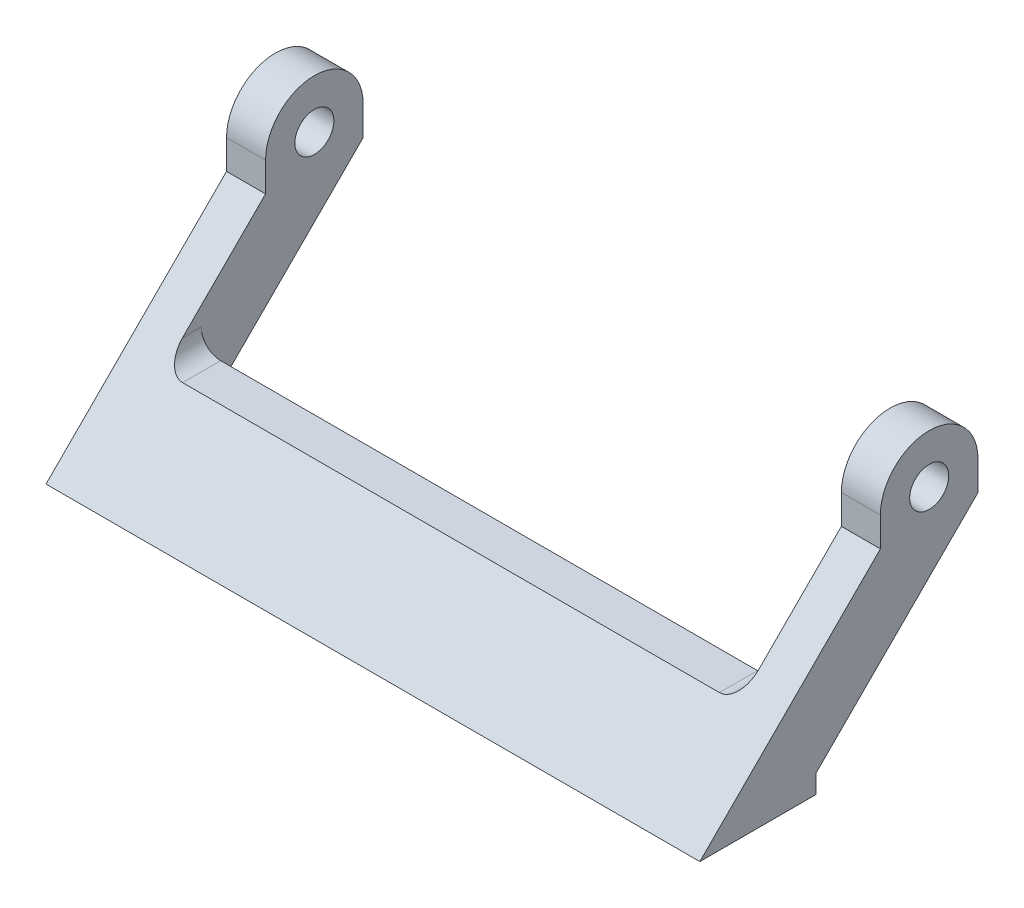
from build123d import *

# Parameters (mm, degrees)
ESBO_O1_R                  = 2
RESSALTO_EXTRUS_O1_DEPTH   = 33.5
CORTE_EXTRUS_O3_START      = -5
CORTE_EXTRUS_O3_DEPTH      = 23.196699141
CORTE_EXTRUS_O4_DEPTH      = 47.084705336
CORTE_EXTRUS_O4_DEPTH_BACK = 47.084705336
ESBO_O4_W                  = 59
ESBO_O4_H                  = 6.231727984
CORTE_EXTRUS_O5_DEPTH      = 44.128413036
RESSALTO_EXTRUS_O3_START   = -29.398953743
RESSALTO_EXTRUS_O3_DEPTH   = 58.797908802
ESBO_O6_W                  = 59
ESBO_O6_H                  = 4.4
RESSALTO_EXTRUS_O4_DEPTH   = 0.5
CORTE_EXTRUS_O6_DEPTH      = 71.593909086
FILETE1_R                  = 2


# Read off the part's stored shape, not the designer's step: Corte-extrusão3, Ressalto-extrusão3
with BuildPart() as part:
    # Esboço1 → Ressalto-extrusão1 (new, symmetric)
    with BuildSketch(Plane(origin=(0, 0, 0), x_dir=(0, 0, -1), z_dir=(1, 0, 0))):
        with BuildLine():
            Line((-5, 0), (-5, -3))
            Line((-5, -3), (-23.5, -21.5))
            Line((-23.5, -21.5), (-11.6, -21.5))
            Line((-11.6, -21.5), (-11.6, -19.6))
            Line((-11.6, -19.6), (5, -3))
            Line((5, -3), (5, 0))
            ThreePointArc((5, 0), (0, 5), (-5, 0))
        make_face()
        Circle(ESBO_O1_R, mode=Mode.SUBTRACT)
    extrude(amount=RESSALTO_EXTRUS_O1_DEPTH, both=True)

    # Corte-extrusão3 outline → Corte-extrusão3 (cut)
    with BuildSketch(Plane.XY.offset(CORTE_EXTRUS_O3_START)):
        with BuildLine():
            Line((-25.5, -16.196699141), (25.5, -16.196699141))
            add(Edge.make_bspline(
                [(25.5, -16.196699141), (29.5, -16.196699141), (29.5, -13.368272016)],
                knots=[3.141592654, 3.141592654, 3.141592654, 4.71238898, 4.71238898, 4.71238898], degree=2, weights=[1, 0.707106781, 1]))
            Line((29.5, -13.368272016), (29.5, 6))
            Line((29.5, 6), (-29.5, 6))
            Line((-29.5, 6), (-29.5, -13.368272016))
            add(Edge.make_bspline(
                [(-29.5, -13.368272016), (-29.5, -16.196699141), (-25.5, -16.196699141)],
                knots=[4.71238898, 4.71238898, 4.71238898, 6.283185307, 6.283185307, 6.283185307], degree=2, weights=[1, 0.707106781, 1]))
        make_face()
    extrude(amount=CORTE_EXTRUS_O3_DEPTH, mode=Mode.SUBTRACT)

    # Esboço4 → Corte-extrusão4 (cut, two sides: drawn at the far end of the back side and taken through both)
    with BuildSketch(Plane(origin=(0, -16.196699141, 0), x_dir=(1, 0, 0), z_dir=(0, 1, 0)).offset(-CORTE_EXTRUS_O4_DEPTH_BACK)):
        with Locations((0, -8.484136008)):
            Rectangle(ESBO_O4_W, ESBO_O4_H)
    extrude(amount=CORTE_EXTRUS_O4_DEPTH + CORTE_EXTRUS_O4_DEPTH_BACK, mode=Mode.SUBTRACT)

    # Esboço5 → Corte-extrusão5 (cut, through all)
    with BuildSketch(Plane(origin=(0, 0, 11.6), x_dir=(-1, 0, 0), z_dir=(0, 0, -1))):
        with BuildLine():
            Line((29.398953619, -14), (29.5, -14))
            Line((29.5, -14), (29.5, -13.368272016))
            add(Edge.make_bspline(
                [(29.398953619, -14), (29.423863493, -13.923129609), (29.445428126, -13.845331175), (29.463538827, -13.766752142), (29.478105641, -13.68755334), (29.489060697, -13.607909452), (29.49636233, -13.528009486), (29.5, -13.448057281), (29.5, -13.368272016)],
                knots=[0.878269136, 0.878269136, 0.878269136, 0.878269136, 0.878269136, 0.878269136, 0.878269136, 0.878269136, 0.878269136, 1, 1, 1, 1, 1, 1, 1, 1, 1], degree=8))
        make_face()
        with BuildLine():
            Line((-29.5, -14), (-29.39895364, -14))
            add(Edge.make_bspline(
                [(-29.5, -13.368272016), (-29.5, -13.38237401), (-29.499886362, -13.396480452), (-29.499658961, -13.410590284), (-29.499317701, -13.424702445), (-29.498862515, -13.438815874), (-29.498293368, -13.452929509), (-29.497610253, -13.467042285), (-29.493100454, -13.546882135), (-29.48691474, -13.612580226), (-29.478257806, -13.678128457), (-29.467147216, -13.743415855), (-29.45361408, -13.808339118), (-29.437701062, -13.872802316), (-29.419460639, -13.936716614), (-29.39895364, -14)],
                knots=[0, 0, 0, 0, 0, 0, 0, 0, 0, 0.021519038, 0.021519038, 0.021519038, 0.021519038, 0.021519038, 0.021519038, 0.021519038, 0.121755683, 0.121755683, 0.121755683, 0.121755683, 0.121755683, 0.121755683, 0.121755683, 0.121755683, 0.121755683], degree=8))
            Line((-29.5, -13.368272016), (-29.5, -14))
        make_face()
    extrude(amount=-CORTE_EXTRUS_O5_DEPTH, mode=Mode.SUBTRACT)

    # Ressalto-extrusão3 outline → Ressalto-extrusão3 (add)
    with BuildSketch(Plane.YZ.offset(RESSALTO_EXTRUS_O3_START)):
        Polygon((-14, 16), (-16.196699141, 18.196699141), (-16.196699141, 11.6), (-14, 11.6), align=None)
    extrude(amount=RESSALTO_EXTRUS_O3_DEPTH)

    # Esboço6 → Ressalto-extrusão4 (add)
    with BuildSketch(Plane(origin=(0, -14, 0), x_dir=(1, 0, 0), z_dir=(0, 1, 0))):
        with Locations((0, -13.8)):
            Rectangle(ESBO_O6_W, ESBO_O6_H)
    extrude(amount=RESSALTO_EXTRUS_O4_DEPTH)

    # Esboço7 → Corte-extrusão6 (cut, through all)
    with BuildSketch(Plane.ZY.offset(29.5)):
        Polygon((16, -13.5), (15.5, -13.5), (16, -14), align=None)
    extrude(amount=-CORTE_EXTRUS_O6_DEPTH, mode=Mode.SUBTRACT)

    # Filete1
    filete1_edges = [part.edges().sort_by_distance(p)[0] for p in [
        (29.5, -13.5, 13.55),
        (-29.5, -13.5, 13.55),
    ]]
    fillet(filete1_edges, radius=FILETE1_R)


solid = part.part
